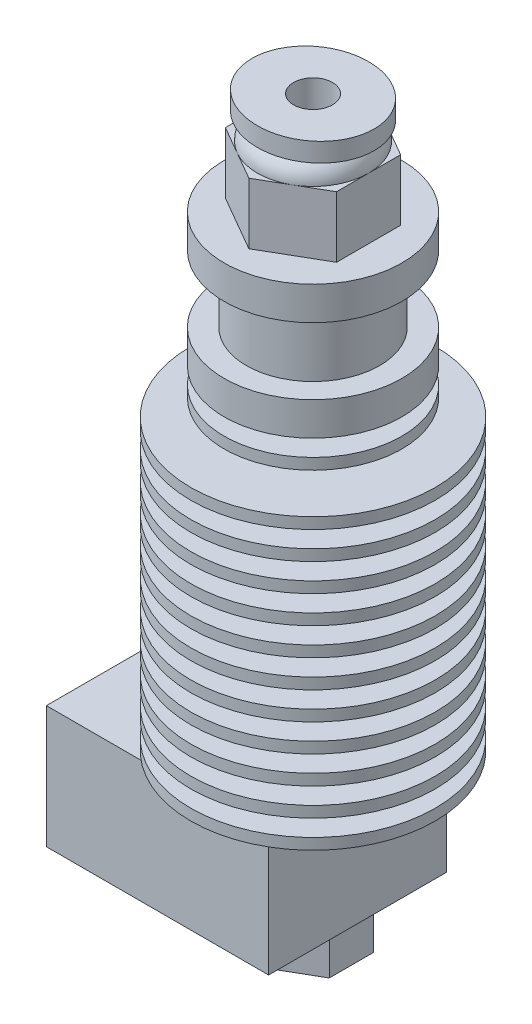
from build123d import *

# Parameters (mm, degrees)
SALIENTE_EXTRUIR1_DEPTH = 5.5
CROQUIS3_R              = 5
SALIENTE_EXTRUIR2_DEPTH = 2
REDONDEO1_R             = 2
CROQUIS4_RX             = 5.5
CROQUIS4_RY             = 5
SALIENTE_EXTRUIR3_DEPTH = 1.7
CROQUIS5_W              = 20
CROQUIS5_H              = 16
SALIENTE_EXTRUIR4_DEPTH = 11
SALIENTE_EXTRUIR5_START = 0.5
CROQUIS6_R              = 2.5
SALIENTE_EXTRUIR5_DEPTH = 0.5
SALIENTE_EXTRUIR6_DEPTH = 3
CROQUIS8_R              = 2.15
SALIENTE_EXTRUIR7_DEPTH = 2
SALIENTE_EXTRUIR7_TAPER = 44
CROQUIS9_R              = 1.75
CORTAR_EXTRUIR1_DEPTH   = 60


with BuildPart() as part:
    # Croquis1 → Revolución1 (revolve)
    with BuildSketch(Plane.XY, mode=Mode.PRIVATE) as revoluci_n1_sk:
        Polygon((0, 0), (0, 42), (8, 42), (8, 39), (6, 39), (6, 33), (8, 33), (8, 30), (4.5, 30), (4.5, 28.5), (8, 28.5), (8, 27.5), (4.5, 27.5), (4.5, 26), (11, 26), (11, 25), (4.5, 25), (4.5, 23.5), (11, 23.5), (11, 22.5), (4.5, 22.5), (4.541860465, 21), (11, 21), (11, 20), (4.569767442, 20), (4.611627907, 18.5), (11, 18.5), (11, 17.5), (4.639534884, 17.5), (4.681395349, 16), (11, 16), (11, 15), (4.709302326, 15), (4.751162791, 13.5), (11, 13.5), (11, 12.5), (4.779069767, 12.5), (4.820930233, 11), (11, 11), (11, 10), (4.848837209, 10), (4.890697674, 8.5), (11, 8.5), (11, 7.5), (4.918604651, 7.5), (4.960465116, 6), (11, 6), (11, 5), (4.988372093, 5), (5.030232558, 3.5), (11, 3.5), (11, 2.5), (5.058139535, 2.5), (5.1, 1), (11, 1), (11, 0), (2.5, 0), (2.5, -0.5), (0, -0.5), align=None)
    revolve(revoluci_n1_sk.sketch.rotate(Axis((0, 0, 0), (0, 1, 0)), 90), axis=Axis((0, 0, 0), (0, 1, 0)))

    # Croquis2 → Saliente-Extruir1 (add)
    with BuildSketch(Plane(origin=(0, 42, 0), x_dir=(1, 0, 0), z_dir=(0, 1, 0))):
        Polygon((0, 5.773502692), (-5, 2.886751346), (-5, -2.886751346), (0, -5.773502692), (5, -2.886751346), (5, 2.886751346), align=None)
    extrude(amount=SALIENTE_EXTRUIR1_DEPTH)

    # Croquis3 → Saliente-Extruir2 (add)
    with BuildSketch(Plane(origin=(0, 47.5, 0), x_dir=(1, 0, 0), z_dir=(0, 1, 0))):
        with Locations(Location((0, 0, 0), (0, 0, 60))):
            Circle(CROQUIS3_R)
    extrude(amount=SALIENTE_EXTRUIR2_DEPTH)

    # Redondeo1
    redondeo1_edges = [part.edges().sort_by_distance(p)[0] for p in [
        (-2.5, 49.5, 4.330127019),
    ]]
    fillet(redondeo1_edges, radius=REDONDEO1_R - 0.0001)  # a hair under: the kernel refuses the full size

    # Croquis4 → Saliente-Extruir3 (add)
    with BuildSketch(Plane(origin=(0, 49.5, 0), x_dir=(1, 0, 0), z_dir=(0, 1, 0))):
        with Locations(Location((0, 0), (0, 0, -180))):
            Ellipse(CROQUIS4_RX, CROQUIS4_RY)
    extrude(amount=SALIENTE_EXTRUIR3_DEPTH)

    # Croquis5 → Saliente-Extruir4 (add)
    with BuildSketch(Plane(origin=(0, -0.5, 0), x_dir=(-1, 0, 0), z_dir=(0, -1, 0))):
        with Locations((6, 0)):
            Rectangle(CROQUIS5_W, CROQUIS5_H)
    extrude(amount=SALIENTE_EXTRUIR4_DEPTH)

    # Croquis6 → Saliente-Extruir5 (add)
    with BuildSketch(Plane.XZ.offset(11.5).offset(SALIENTE_EXTRUIR5_START)):
        with Locations(Location((0, 0, 0), (0, 0, 270))):
            Circle(CROQUIS6_R)
    extrude(amount=-SALIENTE_EXTRUIR5_DEPTH)

    # Croquis7 → Saliente-Extruir6 (add)
    with BuildSketch(Plane.XZ.offset(12)):
        Polygon((0, -4), (3.464101615, -2), (3.464101615, 2), (0, 4), (-3.464101615, 2), (-3.464101615, -2), align=None)
    extrude(amount=SALIENTE_EXTRUIR6_DEPTH)

    # Croquis8 → Saliente-Extruir7 (add)
    with BuildSketch(Plane.XZ.offset(15)):
        Circle(CROQUIS8_R)
    extrude(amount=SALIENTE_EXTRUIR7_DEPTH, taper=SALIENTE_EXTRUIR7_TAPER)

    # Croquis9 → Cortar-Extruir1 (cut)
    with BuildSketch(Plane(origin=(0, 51.2, 0), x_dir=(1, 0, 0), z_dir=(0, 1, 0))):
        with Locations(Location((0, 0, 0), (0, 0, 270))):
            Circle(CROQUIS9_R)
    extrude(amount=-CORTAR_EXTRUIR1_DEPTH, mode=Mode.SUBTRACT)


solid = part.part
